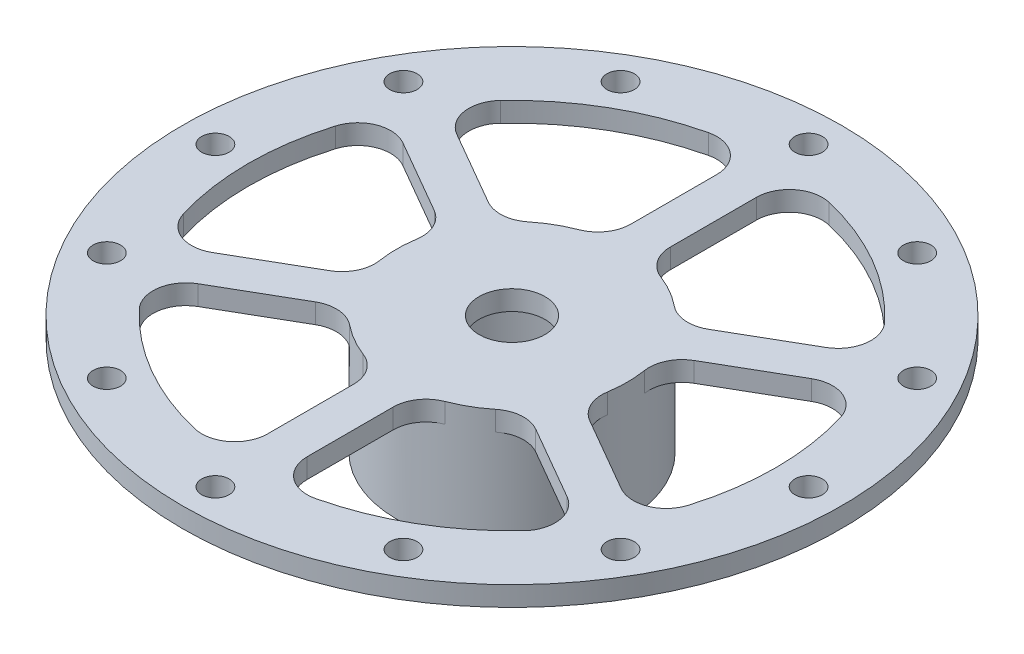
from build123d import *
from build123d.topology import SkipClean

# Parameters (mm, degrees)
SKETCH1_R           = 50
SKETCH1_R_2         = 2.082800000004054
SKETCH1_R_3         = 2.082800000003656
SKETCH1_R_4         = 2.082800000002845
SKETCH1_R_5         = 2.0828000000039606
SKETCH1_R_6         = 2.082800000003402
SKETCH1_R_7         = 2.08280000000247
SKETCH1_R_8         = 2.0828000000019395
SKETCH1_R_9         = 2.082799999999999
SKETCH1_R_10        = 2.082800000000002
SKETCH1_R_11        = 2.082800000001424
SKETCH1_R_12        = 2.0828000000005398
SKETCH1_R_13        = 2.0828000000000024
SKETCH1_R_14        = 5
BOSS_EXTRUDE1_DEPTH = 3
BOSS_EXTRUDE2_START = 15
SKETCH2_R           = 17.500000000000004
SKETCH2_R_2         = 14.5
BOSS_EXTRUDE2_DEPTH = 15
FILLET1_R           = 5


with BuildPart() as part:
    # Sketch1 → Boss-Extrude1 (new body)
    with BuildSketch(Plane(origin=(0, 0, 0), x_dir=(1, 0, 0), z_dir=(0, 1, 0))):
        Circle(SKETCH1_R)
        with BuildLine():
            Line((3.000000000000006, 17.24093964956667), (3.0000000000000027, 39.88734135035826))
            ThreePointArc((2.9999999999999956, 39.88734135035826), (20.000000000000043, 34.64101615137752), (33.0434508988318, 22.54174688653237))
            Line((33.0434508988318, 22.54174688653237), (13.431091721639113, 11.21854603613665))
            ThreePointArc((13.431091721639113, 11.218546036136653), (8.750000000000004, 15.155444566227679), (3.000000000000007, 17.24093964956667))
        make_face(mode=Mode.SUBTRACT)
        with BuildLine():
            Line((-2.999999999999998, 39.88734135035826), (-2.9999999999999942, 17.24093964956667))
            ThreePointArc((-2.9999999999999933, 17.240939649566673), (-8.750000000000005, 15.155444566227677), (-13.431091721639119, 11.218546036136646))
            Line((-13.431091721639117, 11.218546036136646), (-33.04345089883149, 22.541746886532835))
            ThreePointArc((-33.04345089883149, 22.541746886532835), (-19.99999999999979, 34.64101615137766), (-3, 39.88734135035826))
        make_face(mode=Mode.SUBTRACT)
        with Locations((-22.499999999996426, -38.97114317030071)):
            Circle(SKETCH1_R_2, mode=Mode.SUBTRACT)
        with Locations((-38.97114317029687, -22.50000000000167)):
            Circle(SKETCH1_R_3, mode=Mode.SUBTRACT)
        with Locations((-44.99999999999809, -1.91571e-12)):
            Circle(SKETCH1_R_4, mode=Mode.SUBTRACT)
        with Locations((3.82253e-12, -45)):
            Circle(SKETCH1_R_5, mode=Mode.SUBTRACT)
        with Locations((22.500000000003574, -38.971143170298774)):
            Circle(SKETCH1_R_6, mode=Mode.SUBTRACT)
        with Locations((38.97114317030261, -22.49999999999834)):
            Circle(SKETCH1_R_7, mode=Mode.SUBTRACT)
        with Locations((-38.971143170298795, 22.499999999998316)):
            Circle(SKETCH1_R_8, mode=Mode.SUBTRACT)
        with Locations((-22.499999999999492, 38.971143170300024)):
            Circle(SKETCH1_R_9, mode=Mode.SUBTRACT)
        with BuildLine():
            ThreePointArc((-36.043450898831914, -17.345594463825474), (-40, 4.1346e-13), (-36.043450898831544, 17.345594463826234))
            Line((-36.04345089883155, 17.345594463826238), (-16.431091721639113, 6.022393613430014))
            ThreePointArc((-16.431091721639117, 6.022393613430017), (-17.500000000000004, 2.14e-15), (-16.431091721639117, -6.02239361343002))
            Line((-16.431091721639113, -6.022393613430021), (-36.043450898831914, -17.345594463825478))
        make_face(mode=Mode.SUBTRACT)
        with BuildLine():
            ThreePointArc((-3.000000000000284, -39.88734135035824), (-20.00000000000029, -34.64101615137737), (-33.04345089883196, -22.541746886532138))
            Line((-33.04345089883196, -22.541746886532138), (-13.431091721639113, -11.218546036136654))
            ThreePointArc((-13.431091721639111, -11.218546036136656), (-8.749999999999995, -15.155444566227683), (-3.000000000000005, -17.24093964956667))
            Line((-3.000000000000004, -17.24093964956667), (-3.00000000000028, -39.88734135035824))
        make_face(mode=Mode.SUBTRACT)
        with BuildLine():
            ThreePointArc((33.043450898831644, -22.541746886532607), (19.999999999999787, -34.64101615137767), (2.9999999999997025, -39.887341350358284))
            Line((2.9999999999997202, -39.887341350358284), (2.9999999999999964, -17.24093964956667))
            ThreePointArc((2.9999999999999836, -17.240939649566673), (8.74999999999999, -15.155444566227686), (13.431091721639108, -11.21854603613666))
            Line((13.431091721639113, -11.218546036136653), (33.04345089883165, -22.541746886532607))
        make_face(mode=Mode.SUBTRACT)
        with BuildLine():
            Line((36.04345089883167, -17.345594463825986), (16.431091721639113, -6.022393613430021))
            ThreePointArc((16.431091721639117, -6.022393613430022), (17.500000000000007, -4.44e-15), (16.431091721639117, 6.022393613430015))
            Line((16.431091721639113, 6.022393613430015), (36.04345089883179, 17.34559446382573))
            ThreePointArc((36.04345089883179, 17.34559446382573), (40.00000000000001, -1.4388e-13), (36.043450898831665, -17.34559446382599))
        make_face(mode=Mode.SUBTRACT)
        with Locations((22.50000000000005, 38.97114317029971)):
            Circle(SKETCH1_R_10, mode=Mode.SUBTRACT)
        with Locations((45.000000000001904, 1.9102e-12)):
            Circle(SKETCH1_R_11, mode=Mode.SUBTRACT)
        with Locations((38.97114317030069, 22.500000000001656)):
            Circle(SKETCH1_R_12, mode=Mode.SUBTRACT)
        with Locations((2.13e-15, 45)):
            Circle(SKETCH1_R_13, mode=Mode.SUBTRACT)
        Circle(SKETCH1_R_14, mode=Mode.SUBTRACT)
    extrude(amount=BOSS_EXTRUDE1_DEPTH)

    # Sketch2 → Boss-Extrude2 (add)
    with SkipClean():  # the faces are left unmerged after this step: merging them gives an invalid solid
        with BuildSketch(Plane.XZ.offset(BOSS_EXTRUDE2_START)):
            Circle(SKETCH2_R)
            Circle(SKETCH2_R_2, mode=Mode.SUBTRACT)
        extrude(amount=-BOSS_EXTRUDE2_DEPTH)

    # Fillet1
    fillet1_edges = [part.edges().sort_by_distance(p)[0] for p in [
        (16.431091721639113, 1.5, -6.022393613430016),
        (36.04345089883179, 1.5, -17.34559446382573),
        (36.043450898831665, 1.5, 17.345594463825986),
        (16.431091721639113, 1.5, 6.0223936134300216),
        (33.04345089883179, 1.5, -22.54174688653237),
        (13.431091721639113, 1.5, -11.218546036136651),
        (3.000000000000006, 1.5, -17.24093964956667),
        (2.999999999999999, 1.5, -39.887341350358255),
        (-3, 1.5, -39.88734135035827),
        (-2.999999999999994, 1.5, -17.24093964956667),
        (-13.431091721639117, 1.5, -11.218546036136644),
        (-33.04345089883149, 1.5, -22.541746886532835),
        (-36.04345089883155, 1.5, -17.345594463826238),
        (-16.431091721639113, 1.5, -6.022393613430016),
        (-16.431091721639113, 1.5, 6.0223936134300216),
        (-36.04345089883192, 1.5, 17.345594463825478),
        (-3.0000000000002824, 1.5, 39.88734135035824),
        (-33.04345089883196, 1.5, 22.541746886532138),
        (-13.431091721639113, 1.5, 11.218546036136654),
        (-3.0000000000000036, 1.5, 17.24093964956667),
        (2.99999999999971, 1.5, 39.887341350358284),
        (2.9999999999999902, 1.5, 17.24093964956667),
        (13.43109172163911, 1.5, 11.218546036136658),
        (33.04345089883165, 1.5, 22.541746886532607),
    ]]
    fillet(fillet1_edges, radius=FILLET1_R)


solid = part.part
